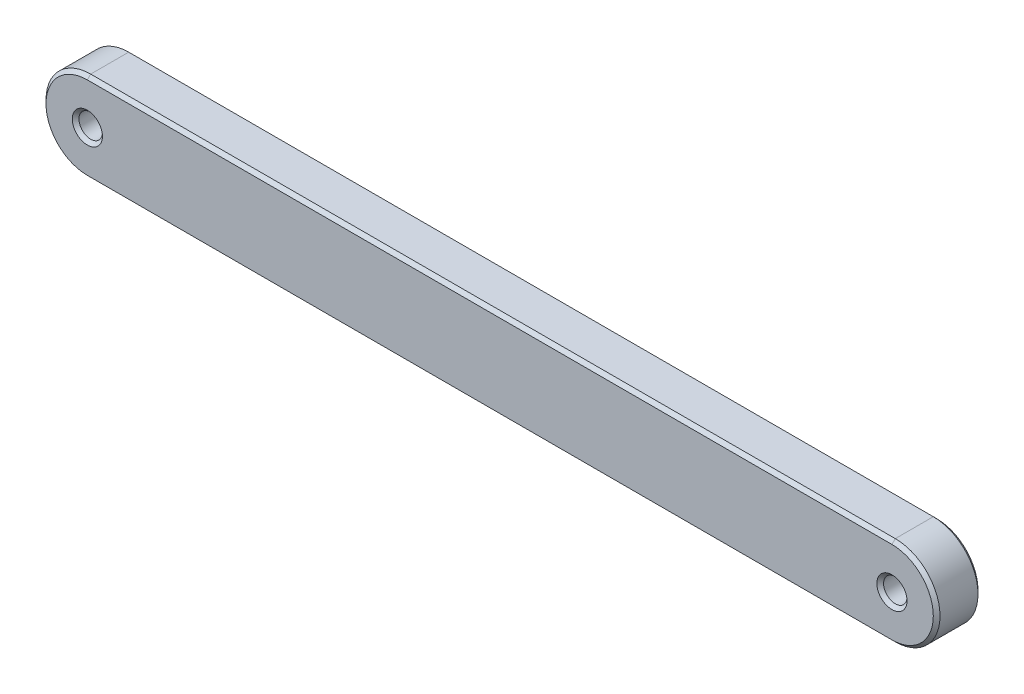
from build123d import *

# Parameters (mm, degrees)
SKETCH1_R           = 2.625
BOSS_EXTRUDE1_DEPTH = 10
SKETCH3_R           = 6.5
CUT_EXTRUDE1_DEPTH  = 4
CHAMFER1_SIZE       = 0.75


with BuildPart() as part:
    # Sketch1 → Boss-Extrude1 (new body)
    with BuildSketch(Plane.XY):
        with BuildLine():
            Line((0, 10), (180, 10))
            ThreePointArc((180, 10), (190, 0), (180, -10))
            Line((180, -10), (0, -10))
            ThreePointArc((0, -10), (-10, 0), (0, 10))
        make_face()
        Circle(SKETCH1_R, mode=Mode.SUBTRACT)
        with Locations((180, 0)):
            Circle(SKETCH1_R, mode=Mode.SUBTRACT)
    extrude(amount=BOSS_EXTRUDE1_DEPTH)

    # Sketch3 → Cut-Extrude1 (cut)
    with BuildSketch(Plane(origin=(0, 0, 0), x_dir=(-1, 0, 0), z_dir=(0, 0, -1))):
        Circle(SKETCH3_R)
    extrude(amount=-CUT_EXTRUDE1_DEPTH, mode=Mode.SUBTRACT)

    # Chamfer1
    chamfer1_edges = [part.edges().sort_by_distance(p)[0] for p in [
        (-2.625, 0, 10),
        (177.375, 0, 0),
        (177.375, 0, 10),
        (90, -10, 10),
        (190, 0, 10),
        (-10, 0, 10),
        (90, 10, 10),
        (90, -10, 0),
        (190, 0, 0),
        (-10, 0, 0),
        (90, 10, 0),
        (6.5, 0, 0),
        (-2.625, 0, 4),
    ]]
    chamfer(chamfer1_edges, length=CHAMFER1_SIZE)


solid = part.part
